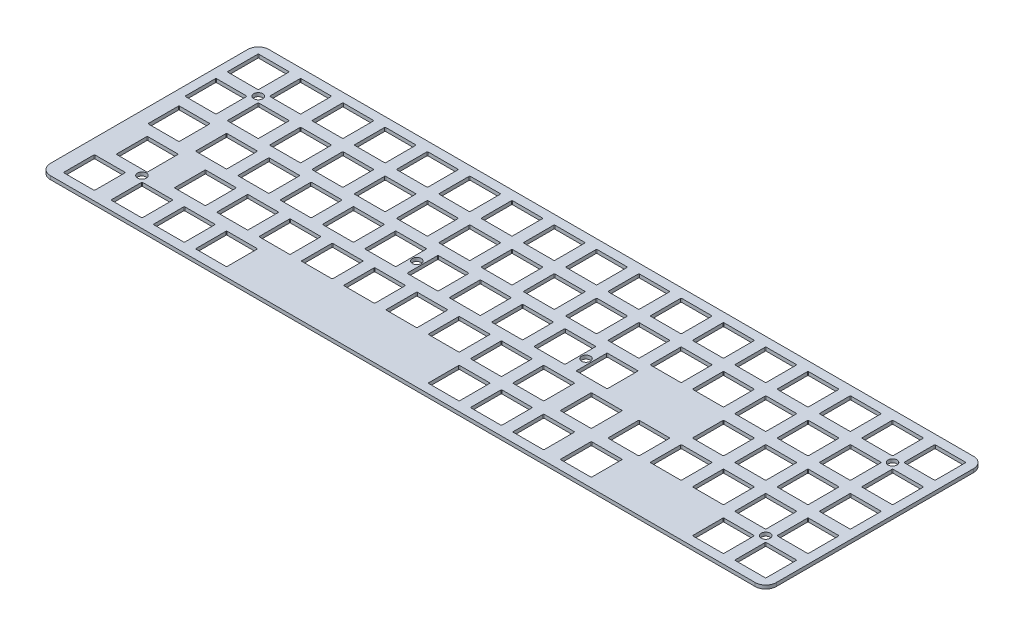
from build123d import *

# Parameters (mm, degrees)
SKETCH2_R           = 2
SKETCH2_W           = 13.9954
SKETCH2_H           = 13.9954
BOSS_EXTRUDE1_DEPTH = 0.79375
FILLET1_R           = 0.3048


with BuildPart() as part:
    # Sketch2 → Boss-Extrude1 (new, symmetric)
    with BuildSketch(Plane(origin=(0, 0, 0), x_dir=(1, 0, 0), z_dir=(0, 1, 0))):
        with BuildLine():
            Line((158.75, -49.2125), (-158.75, -49.2125))
            ThreePointArc((-158.75, -49.2125), (-162.117596045, -47.817596045), (-163.5125, -44.45))
            Line((-163.5125, -44.45), (-163.5125, 44.45))
            ThreePointArc((-163.5125, 44.45), (-162.117596045, 47.817596045), (-158.75, 49.2125))
            Line((-158.75, 49.2125), (158.75, 49.2125))
            ThreePointArc((158.75, 49.2125), (162.117596045, 47.817596045), (163.5125, 44.45))
            Line((163.5125, 44.45), (163.5125, -44.45))
            ThreePointArc((163.5125, -44.45), (162.117596045, -47.817596045), (158.75, -49.2125))
        make_face()
        with Locations((-142.875, 28.575)):
            Circle(SKETCH2_R, mode=Mode.SUBTRACT)
        with Locations((-138.1125, -28.575)):
            Circle(SKETCH2_R, mode=Mode.SUBTRACT)
        with Locations((142.875, 28.575)):
            Circle(SKETCH2_R, mode=Mode.SUBTRACT)
        with Locations((142.875, -28.575)):
            Circle(SKETCH2_R, mode=Mode.SUBTRACT)
        with Locations((-42.8625, 0)):
            Circle(SKETCH2_R, mode=Mode.SUBTRACT)
        with Locations((33.3375, 0)):
            Circle(SKETCH2_R, mode=Mode.SUBTRACT)
        with BuildLine():
            Line((-145.7071, 45.0977), (-159.0929, 45.0977))
            ThreePointArc((-159.0929, 45.0977), (-159.308426147, 45.008426147), (-159.3977, 44.7929))
            Line((-159.3977, 44.7929), (-159.3977, 31.4071))
            ThreePointArc((-159.3977, 31.4071), (-159.308426147, 31.191573853), (-159.0929, 31.1023))
            Line((-159.0929, 31.1023), (-145.7071, 31.1023))
            ThreePointArc((-145.7071, 31.1023), (-145.491573853, 31.191573853), (-145.4023, 31.4071))
            Line((-145.4023, 31.4071), (-145.4023, 44.7929))
            ThreePointArc((-145.4023, 44.7929), (-145.491573853, 45.008426147), (-145.7071, 45.0977))
        make_face(mode=Mode.SUBTRACT)
        with BuildLine():
            Line((-126.6571, 45.0977), (-140.0429, 45.0977))
            ThreePointArc((-140.0429, 45.0977), (-140.258426147, 45.008426147), (-140.3477, 44.7929))
            Line((-140.3477, 44.7929), (-140.3477, 31.4071))
            ThreePointArc((-140.3477, 31.4071), (-140.258426147, 31.191573853), (-140.0429, 31.1023))
            Line((-140.0429, 31.1023), (-126.6571, 31.1023))
            ThreePointArc((-126.6571, 31.1023), (-126.441573853, 31.191573853), (-126.3523, 31.4071))
            Line((-126.3523, 31.4071), (-126.3523, 44.7929))
            ThreePointArc((-126.3523, 44.7929), (-126.441573853, 45.008426147), (-126.6571, 45.0977))
        make_face(mode=Mode.SUBTRACT)
        with BuildLine():
            Line((-107.6071, 45.0977), (-120.9929, 45.0977))
            ThreePointArc((-120.9929, 45.0977), (-121.208426147, 45.008426147), (-121.2977, 44.7929))
            Line((-121.2977, 44.7929), (-121.2977, 31.4071))
            ThreePointArc((-121.2977, 31.4071), (-121.208426147, 31.191573853), (-120.9929, 31.1023))
            Line((-120.9929, 31.1023), (-107.6071, 31.1023))
            ThreePointArc((-107.6071, 31.1023), (-107.391573853, 31.191573853), (-107.3023, 31.4071))
            Line((-107.3023, 31.4071), (-107.3023, 44.7929))
            ThreePointArc((-107.3023, 44.7929), (-107.391573853, 45.008426147), (-107.6071, 45.0977))
        make_face(mode=Mode.SUBTRACT)
        with BuildLine():
            Line((-88.5571, 45.0977), (-101.9429, 45.0977))
            ThreePointArc((-101.9429, 45.0977), (-102.158426147, 45.008426147), (-102.2477, 44.7929))
            Line((-102.2477, 44.7929), (-102.2477, 31.4071))
            ThreePointArc((-102.2477, 31.4071), (-102.158426147, 31.191573853), (-101.9429, 31.1023))
            Line((-101.9429, 31.1023), (-88.5571, 31.1023))
            ThreePointArc((-88.5571, 31.1023), (-88.341573853, 31.191573853), (-88.2523, 31.4071))
            Line((-88.2523, 31.4071), (-88.2523, 44.7929))
            ThreePointArc((-88.2523, 44.7929), (-88.341573853, 45.008426147), (-88.5571, 45.0977))
        make_face(mode=Mode.SUBTRACT)
        with BuildLine():
            Line((-69.5071, 45.0977), (-82.8929, 45.0977))
            ThreePointArc((-82.8929, 45.0977), (-83.108426147, 45.008426147), (-83.1977, 44.7929))
            Line((-83.1977, 44.7929), (-83.1977, 31.4071))
            ThreePointArc((-83.1977, 31.4071), (-83.108426147, 31.191573853), (-82.8929, 31.1023))
            Line((-82.8929, 31.1023), (-69.5071, 31.1023))
            ThreePointArc((-69.5071, 31.1023), (-69.291573853, 31.191573853), (-69.2023, 31.4071))
            Line((-69.2023, 31.4071), (-69.2023, 44.7929))
            ThreePointArc((-69.2023, 44.7929), (-69.291573853, 45.008426147), (-69.5071, 45.0977))
        make_face(mode=Mode.SUBTRACT)
        with BuildLine():
            Line((-50.4571, 45.0977), (-63.8429, 45.0977))
            ThreePointArc((-63.8429, 45.0977), (-64.058426147, 45.008426147), (-64.1477, 44.7929))
            Line((-64.1477, 44.7929), (-64.1477, 31.4071))
            ThreePointArc((-64.1477, 31.4071), (-64.058426147, 31.191573853), (-63.8429, 31.1023))
            Line((-63.8429, 31.1023), (-50.4571, 31.1023))
            ThreePointArc((-50.4571, 31.1023), (-50.241573853, 31.191573853), (-50.1523, 31.4071))
            Line((-50.1523, 31.4071), (-50.1523, 44.7929))
            ThreePointArc((-50.1523, 44.7929), (-50.241573853, 45.008426147), (-50.4571, 45.0977))
        make_face(mode=Mode.SUBTRACT)
        with BuildLine():
            Line((-31.4071, 45.0977), (-44.7929, 45.0977))
            ThreePointArc((-44.7929, 45.0977), (-45.008426147, 45.008426147), (-45.0977, 44.7929))
            Line((-45.0977, 44.7929), (-45.0977, 31.4071))
            ThreePointArc((-45.0977, 31.4071), (-45.008426147, 31.191573853), (-44.7929, 31.1023))
            Line((-44.7929, 31.1023), (-31.4071, 31.1023))
            ThreePointArc((-31.4071, 31.1023), (-31.191573853, 31.191573853), (-31.1023, 31.4071))
            Line((-31.1023, 31.4071), (-31.1023, 44.7929))
            ThreePointArc((-31.1023, 44.7929), (-31.191573853, 45.008426147), (-31.4071, 45.0977))
        make_face(mode=Mode.SUBTRACT)
        with BuildLine():
            Line((-12.3571, 45.0977), (-25.7429, 45.0977))
            ThreePointArc((-25.7429, 45.0977), (-25.958426147, 45.008426147), (-26.0477, 44.7929))
            Line((-26.0477, 44.7929), (-26.0477, 31.4071))
            ThreePointArc((-26.0477, 31.4071), (-25.958426147, 31.191573853), (-25.7429, 31.1023))
            Line((-25.7429, 31.1023), (-12.3571, 31.1023))
            ThreePointArc((-12.3571, 31.1023), (-12.141573853, 31.191573853), (-12.0523, 31.4071))
            Line((-12.0523, 31.4071), (-12.0523, 44.7929))
            ThreePointArc((-12.0523, 44.7929), (-12.141573853, 45.008426147), (-12.3571, 45.0977))
        make_face(mode=Mode.SUBTRACT)
        with BuildLine():
            Line((6.6929, 45.0977), (-6.6929, 45.0977))
            ThreePointArc((-6.6929, 45.0977), (-6.908426147, 45.008426147), (-6.9977, 44.7929))
            Line((-6.9977, 44.7929), (-6.9977, 31.4071))
            ThreePointArc((-6.9977, 31.4071), (-6.908426147, 31.191573853), (-6.6929, 31.1023))
            Line((-6.6929, 31.1023), (6.6929, 31.1023))
            ThreePointArc((6.6929, 31.1023), (6.908426147, 31.191573853), (6.9977, 31.4071))
            Line((6.9977, 31.4071), (6.9977, 44.7929))
            ThreePointArc((6.9977, 44.7929), (6.908426147, 45.008426147), (6.6929, 45.0977))
        make_face(mode=Mode.SUBTRACT)
        with BuildLine():
            Line((25.7429, 45.0977), (12.3571, 45.0977))
            ThreePointArc((12.3571, 45.0977), (12.141573853, 45.008426147), (12.0523, 44.7929))
            Line((12.0523, 44.7929), (12.0523, 31.4071))
            ThreePointArc((12.0523, 31.4071), (12.141573853, 31.191573853), (12.3571, 31.1023))
            Line((12.3571, 31.1023), (25.7429, 31.1023))
            ThreePointArc((25.7429, 31.1023), (25.958426147, 31.191573853), (26.0477, 31.4071))
            Line((26.0477, 31.4071), (26.0477, 44.7929))
            ThreePointArc((26.0477, 44.7929), (25.958426147, 45.008426147), (25.7429, 45.0977))
        make_face(mode=Mode.SUBTRACT)
        with BuildLine():
            Line((44.7929, 45.0977), (31.4071, 45.0977))
            ThreePointArc((31.4071, 45.0977), (31.191573853, 45.008426147), (31.1023, 44.7929))
            Line((31.1023, 44.7929), (31.1023, 31.4071))
            ThreePointArc((31.1023, 31.4071), (31.191573853, 31.191573853), (31.4071, 31.1023))
            Line((31.4071, 31.1023), (44.7929, 31.1023))
            ThreePointArc((44.7929, 31.1023), (45.008426147, 31.191573853), (45.0977, 31.4071))
            Line((45.0977, 31.4071), (45.0977, 44.7929))
            ThreePointArc((45.0977, 44.7929), (45.008426147, 45.008426147), (44.7929, 45.0977))
        make_face(mode=Mode.SUBTRACT)
        with BuildLine():
            Line((63.8429, 45.0977), (50.4571, 45.0977))
            ThreePointArc((50.4571, 45.0977), (50.241573853, 45.008426147), (50.1523, 44.7929))
            Line((50.1523, 44.7929), (50.1523, 31.4071))
            ThreePointArc((50.1523, 31.4071), (50.241573853, 31.191573853), (50.4571, 31.1023))
            Line((50.4571, 31.1023), (63.8429, 31.1023))
            ThreePointArc((63.8429, 31.1023), (64.058426147, 31.191573853), (64.1477, 31.4071))
            Line((64.1477, 31.4071), (64.1477, 44.7929))
            ThreePointArc((64.1477, 44.7929), (64.058426147, 45.008426147), (63.8429, 45.0977))
        make_face(mode=Mode.SUBTRACT)
        with BuildLine():
            Line((82.8929, 45.0977), (69.5071, 45.0977))
            ThreePointArc((69.5071, 45.0977), (69.291573853, 45.008426147), (69.2023, 44.7929))
            Line((69.2023, 44.7929), (69.2023, 31.4071))
            ThreePointArc((69.2023, 31.4071), (69.291573853, 31.191573853), (69.5071, 31.1023))
            Line((69.5071, 31.1023), (82.8929, 31.1023))
            ThreePointArc((82.8929, 31.1023), (83.108426147, 31.191573853), (83.1977, 31.4071))
            Line((83.1977, 31.4071), (83.1977, 44.7929))
            ThreePointArc((83.1977, 44.7929), (83.108426147, 45.008426147), (82.8929, 45.0977))
        make_face(mode=Mode.SUBTRACT)
        with BuildLine():
            Line((101.9429, 45.0977), (88.5571, 45.0977))
            ThreePointArc((88.5571, 45.0977), (88.341573853, 45.008426147), (88.2523, 44.7929))
            Line((88.2523, 44.7929), (88.2523, 31.4071))
            ThreePointArc((88.2523, 31.4071), (88.341573853, 31.191573853), (88.5571, 31.1023))
            Line((88.5571, 31.1023), (101.9429, 31.1023))
            ThreePointArc((101.9429, 31.1023), (102.158426147, 31.191573853), (102.2477, 31.4071))
            Line((102.2477, 31.4071), (102.2477, 44.7929))
            ThreePointArc((102.2477, 44.7929), (102.158426147, 45.008426147), (101.9429, 45.0977))
        make_face(mode=Mode.SUBTRACT)
        with BuildLine():
            Line((120.9929, 45.0977), (107.6071, 45.0977))
            ThreePointArc((107.6071, 45.0977), (107.391573853, 45.008426147), (107.3023, 44.7929))
            Line((107.3023, 44.7929), (107.3023, 31.4071))
            ThreePointArc((107.3023, 31.4071), (107.391573853, 31.191573853), (107.6071, 31.1023))
            Line((107.6071, 31.1023), (120.9929, 31.1023))
            ThreePointArc((120.9929, 31.1023), (121.208426147, 31.191573853), (121.2977, 31.4071))
            Line((121.2977, 31.4071), (121.2977, 44.7929))
            ThreePointArc((121.2977, 44.7929), (121.208426147, 45.008426147), (120.9929, 45.0977))
        make_face(mode=Mode.SUBTRACT)
        with BuildLine():
            Line((140.0429, 45.0977), (126.6571, 45.0977))
            ThreePointArc((126.6571, 45.0977), (126.441573853, 45.008426147), (126.3523, 44.7929))
            Line((126.3523, 44.7929), (126.3523, 31.4071))
            ThreePointArc((126.3523, 31.4071), (126.441573853, 31.191573853), (126.6571, 31.1023))
            Line((126.6571, 31.1023), (140.0429, 31.1023))
            ThreePointArc((140.0429, 31.1023), (140.258426147, 31.191573853), (140.3477, 31.4071))
            Line((140.3477, 31.4071), (140.3477, 44.7929))
            ThreePointArc((140.3477, 44.7929), (140.258426147, 45.008426147), (140.0429, 45.0977))
        make_face(mode=Mode.SUBTRACT)
        with BuildLine():
            Line((159.0929, 45.0977), (145.7071, 45.0977))
            ThreePointArc((145.7071, 45.0977), (145.491573853, 45.008426147), (145.4023, 44.7929))
            Line((145.4023, 44.7929), (145.4023, 31.4071))
            ThreePointArc((145.4023, 31.4071), (145.491573853, 31.191573853), (145.7071, 31.1023))
            Line((145.7071, 31.1023), (159.0929, 31.1023))
            ThreePointArc((159.0929, 31.1023), (159.308426147, 31.191573853), (159.3977, 31.4071))
            Line((159.3977, 31.4071), (159.3977, 44.7929))
            ThreePointArc((159.3977, 44.7929), (159.308426147, 45.008426147), (159.0929, 45.0977))
        make_face(mode=Mode.SUBTRACT)
        with BuildLine():
            Line((-126.6571, 26.0477), (-140.0429, 26.0477))
            ThreePointArc((-140.0429, 26.0477), (-140.258426147, 25.958426147), (-140.3477, 25.7429))
            Line((-140.3477, 25.7429), (-140.3477, 12.3571))
            ThreePointArc((-140.3477, 12.3571), (-140.258426147, 12.141573853), (-140.0429, 12.0523))
            Line((-140.0429, 12.0523), (-126.6571, 12.0523))
            ThreePointArc((-126.6571, 12.0523), (-126.441573853, 12.141573853), (-126.3523, 12.3571))
            Line((-126.3523, 12.3571), (-126.3523, 25.7429))
            ThreePointArc((-126.3523, 25.7429), (-126.441573853, 25.958426147), (-126.6571, 26.0477))
        make_face(mode=Mode.SUBTRACT)
        with BuildLine():
            Line((-107.6071, 26.0477), (-120.9929, 26.0477))
            ThreePointArc((-120.9929, 26.0477), (-121.208426147, 25.958426147), (-121.2977, 25.7429))
            Line((-121.2977, 25.7429), (-121.2977, 12.3571))
            ThreePointArc((-121.2977, 12.3571), (-121.208426147, 12.141573853), (-120.9929, 12.0523))
            Line((-120.9929, 12.0523), (-107.6071, 12.0523))
            ThreePointArc((-107.6071, 12.0523), (-107.391573853, 12.141573853), (-107.3023, 12.3571))
            Line((-107.3023, 12.3571), (-107.3023, 25.7429))
            ThreePointArc((-107.3023, 25.7429), (-107.391573853, 25.958426147), (-107.6071, 26.0477))
        make_face(mode=Mode.SUBTRACT)
        with BuildLine():
            Line((-88.5571, 26.0477), (-101.9429, 26.0477))
            ThreePointArc((-101.9429, 26.0477), (-102.158426147, 25.958426147), (-102.2477, 25.7429))
            Line((-102.2477, 25.7429), (-102.2477, 12.3571))
            ThreePointArc((-102.2477, 12.3571), (-102.158426147, 12.141573853), (-101.9429, 12.0523))
            Line((-101.9429, 12.0523), (-88.5571, 12.0523))
            ThreePointArc((-88.5571, 12.0523), (-88.341573853, 12.141573853), (-88.2523, 12.3571))
            Line((-88.2523, 12.3571), (-88.2523, 25.7429))
            ThreePointArc((-88.2523, 25.7429), (-88.341573853, 25.958426147), (-88.5571, 26.0477))
        make_face(mode=Mode.SUBTRACT)
        with BuildLine():
            Line((-69.5071, 26.0477), (-82.8929, 26.0477))
            ThreePointArc((-82.8929, 26.0477), (-83.108426147, 25.958426147), (-83.1977, 25.7429))
            Line((-83.1977, 25.7429), (-83.1977, 12.3571))
            ThreePointArc((-83.1977, 12.3571), (-83.108426147, 12.141573853), (-82.8929, 12.0523))
            Line((-82.8929, 12.0523), (-69.5071, 12.0523))
            ThreePointArc((-69.5071, 12.0523), (-69.291573853, 12.141573853), (-69.2023, 12.3571))
            Line((-69.2023, 12.3571), (-69.2023, 25.7429))
            ThreePointArc((-69.2023, 25.7429), (-69.291573853, 25.958426147), (-69.5071, 26.0477))
        make_face(mode=Mode.SUBTRACT)
        with BuildLine():
            Line((-50.4571, 26.0477), (-63.8429, 26.0477))
            ThreePointArc((-63.8429, 26.0477), (-64.058426147, 25.958426147), (-64.1477, 25.7429))
            Line((-64.1477, 25.7429), (-64.1477, 12.3571))
            ThreePointArc((-64.1477, 12.3571), (-64.058426147, 12.141573853), (-63.8429, 12.0523))
            Line((-63.8429, 12.0523), (-50.4571, 12.0523))
            ThreePointArc((-50.4571, 12.0523), (-50.241573853, 12.141573853), (-50.1523, 12.3571))
            Line((-50.1523, 12.3571), (-50.1523, 25.7429))
            ThreePointArc((-50.1523, 25.7429), (-50.241573853, 25.958426147), (-50.4571, 26.0477))
        make_face(mode=Mode.SUBTRACT)
        with BuildLine():
            Line((-31.4071, 26.0477), (-44.7929, 26.0477))
            ThreePointArc((-44.7929, 26.0477), (-45.008426147, 25.958426147), (-45.0977, 25.7429))
            Line((-45.0977, 25.7429), (-45.0977, 12.3571))
            ThreePointArc((-45.0977, 12.3571), (-45.008426147, 12.141573853), (-44.7929, 12.0523))
            Line((-44.7929, 12.0523), (-31.4071, 12.0523))
            ThreePointArc((-31.4071, 12.0523), (-31.191573853, 12.141573853), (-31.1023, 12.3571))
            Line((-31.1023, 12.3571), (-31.1023, 25.7429))
            ThreePointArc((-31.1023, 25.7429), (-31.191573853, 25.958426147), (-31.4071, 26.0477))
        make_face(mode=Mode.SUBTRACT)
        with BuildLine():
            Line((-12.3571, 26.0477), (-25.7429, 26.0477))
            ThreePointArc((-25.7429, 26.0477), (-25.958426147, 25.958426147), (-26.0477, 25.7429))
            Line((-26.0477, 25.7429), (-26.0477, 12.3571))
            ThreePointArc((-26.0477, 12.3571), (-25.958426147, 12.141573853), (-25.7429, 12.0523))
            Line((-25.7429, 12.0523), (-12.3571, 12.0523))
            ThreePointArc((-12.3571, 12.0523), (-12.141573853, 12.141573853), (-12.0523, 12.3571))
            Line((-12.0523, 12.3571), (-12.0523, 25.7429))
            ThreePointArc((-12.0523, 25.7429), (-12.141573853, 25.958426147), (-12.3571, 26.0477))
        make_face(mode=Mode.SUBTRACT)
        with BuildLine():
            Line((6.6929, 26.0477), (-6.6929, 26.0477))
            ThreePointArc((-6.6929, 26.0477), (-6.908426147, 25.958426147), (-6.9977, 25.7429))
            Line((-6.9977, 25.7429), (-6.9977, 12.3571))
            ThreePointArc((-6.9977, 12.3571), (-6.908426147, 12.141573853), (-6.6929, 12.0523))
            Line((-6.6929, 12.0523), (6.6929, 12.0523))
            ThreePointArc((6.6929, 12.0523), (6.908426147, 12.141573853), (6.9977, 12.3571))
            Line((6.9977, 12.3571), (6.9977, 25.7429))
            ThreePointArc((6.9977, 25.7429), (6.908426147, 25.958426147), (6.6929, 26.0477))
        make_face(mode=Mode.SUBTRACT)
        with BuildLine():
            Line((25.7429, 26.0477), (12.3571, 26.0477))
            ThreePointArc((12.3571, 26.0477), (12.141573853, 25.958426147), (12.0523, 25.7429))
            Line((12.0523, 25.7429), (12.0523, 12.3571))
            ThreePointArc((12.0523, 12.3571), (12.141573853, 12.141573853), (12.3571, 12.0523))
            Line((12.3571, 12.0523), (25.7429, 12.0523))
            ThreePointArc((25.7429, 12.0523), (25.958426147, 12.141573853), (26.0477, 12.3571))
            Line((26.0477, 12.3571), (26.0477, 25.7429))
            ThreePointArc((26.0477, 25.7429), (25.958426147, 25.958426147), (25.7429, 26.0477))
        make_face(mode=Mode.SUBTRACT)
        with BuildLine():
            Line((44.7929, 26.0477), (31.4071, 26.0477))
            ThreePointArc((31.4071, 26.0477), (31.191573853, 25.958426147), (31.1023, 25.7429))
            Line((31.1023, 25.7429), (31.1023, 12.3571))
            ThreePointArc((31.1023, 12.3571), (31.191573853, 12.141573853), (31.4071, 12.0523))
            Line((31.4071, 12.0523), (44.7929, 12.0523))
            ThreePointArc((44.7929, 12.0523), (45.008426147, 12.141573853), (45.0977, 12.3571))
            Line((45.0977, 12.3571), (45.0977, 25.7429))
            ThreePointArc((45.0977, 25.7429), (45.008426147, 25.958426147), (44.7929, 26.0477))
        make_face(mode=Mode.SUBTRACT)
        with BuildLine():
            Line((63.8429, 26.0477), (50.4571, 26.0477))
            ThreePointArc((50.4571, 26.0477), (50.241573853, 25.958426147), (50.1523, 25.7429))
            Line((50.1523, 25.7429), (50.1523, 12.3571))
            ThreePointArc((50.1523, 12.3571), (50.241573853, 12.141573853), (50.4571, 12.0523))
            Line((50.4571, 12.0523), (63.8429, 12.0523))
            ThreePointArc((63.8429, 12.0523), (64.058426147, 12.141573853), (64.1477, 12.3571))
            Line((64.1477, 12.3571), (64.1477, 25.7429))
            ThreePointArc((64.1477, 25.7429), (64.058426147, 25.958426147), (63.8429, 26.0477))
        make_face(mode=Mode.SUBTRACT)
        with BuildLine():
            Line((82.8929, 26.0477), (69.5071, 26.0477))
            ThreePointArc((69.5071, 26.0477), (69.291573853, 25.958426147), (69.2023, 25.7429))
            Line((69.2023, 25.7429), (69.2023, 12.3571))
            ThreePointArc((69.2023, 12.3571), (69.291573853, 12.141573853), (69.5071, 12.0523))
            Line((69.5071, 12.0523), (82.8929, 12.0523))
            ThreePointArc((82.8929, 12.0523), (83.108426147, 12.141573853), (83.1977, 12.3571))
            Line((83.1977, 12.3571), (83.1977, 25.7429))
            ThreePointArc((83.1977, 25.7429), (83.108426147, 25.958426147), (82.8929, 26.0477))
        make_face(mode=Mode.SUBTRACT)
        with BuildLine():
            Line((101.9429, 26.0477), (88.5571, 26.0477))
            ThreePointArc((88.5571, 26.0477), (88.341573853, 25.958426147), (88.2523, 25.7429))
            Line((88.2523, 25.7429), (88.2523, 12.3571))
            ThreePointArc((88.2523, 12.3571), (88.341573853, 12.141573853), (88.5571, 12.0523))
            Line((88.5571, 12.0523), (101.9429, 12.0523))
            ThreePointArc((101.9429, 12.0523), (102.158426147, 12.141573853), (102.2477, 12.3571))
            Line((102.2477, 12.3571), (102.2477, 25.7429))
            ThreePointArc((102.2477, 25.7429), (102.158426147, 25.958426147), (101.9429, 26.0477))
        make_face(mode=Mode.SUBTRACT)
        with BuildLine():
            Line((120.9929, 26.0477), (107.6071, 26.0477))
            ThreePointArc((107.6071, 26.0477), (107.391573853, 25.958426147), (107.3023, 25.7429))
            Line((107.3023, 25.7429), (107.3023, 12.3571))
            ThreePointArc((107.3023, 12.3571), (107.391573853, 12.141573853), (107.6071, 12.0523))
            Line((107.6071, 12.0523), (120.9929, 12.0523))
            ThreePointArc((120.9929, 12.0523), (121.208426147, 12.141573853), (121.2977, 12.3571))
            Line((121.2977, 12.3571), (121.2977, 25.7429))
            ThreePointArc((121.2977, 25.7429), (121.208426147, 25.958426147), (120.9929, 26.0477))
        make_face(mode=Mode.SUBTRACT)
        with BuildLine():
            Line((140.0429, 26.0477), (126.6571, 26.0477))
            ThreePointArc((126.6571, 26.0477), (126.441573853, 25.958426147), (126.3523, 25.7429))
            Line((126.3523, 25.7429), (126.3523, 12.3571))
            ThreePointArc((126.3523, 12.3571), (126.441573853, 12.141573853), (126.6571, 12.0523))
            Line((126.6571, 12.0523), (140.0429, 12.0523))
            ThreePointArc((140.0429, 12.0523), (140.258426147, 12.141573853), (140.3477, 12.3571))
            Line((140.3477, 12.3571), (140.3477, 25.7429))
            ThreePointArc((140.3477, 25.7429), (140.258426147, 25.958426147), (140.0429, 26.0477))
        make_face(mode=Mode.SUBTRACT)
        with BuildLine():
            Line((159.0929, 26.0477), (145.7071, 26.0477))
            ThreePointArc((145.7071, 26.0477), (145.491573853, 25.958426147), (145.4023, 25.7429))
            Line((145.4023, 25.7429), (145.4023, 12.3571))
            ThreePointArc((145.4023, 12.3571), (145.491573853, 12.141573853), (145.7071, 12.0523))
            Line((145.7071, 12.0523), (159.0929, 12.0523))
            ThreePointArc((159.0929, 12.0523), (159.308426147, 12.141573853), (159.3977, 12.3571))
            Line((159.3977, 12.3571), (159.3977, 25.7429))
            ThreePointArc((159.3977, 25.7429), (159.308426147, 25.958426147), (159.0929, 26.0477))
        make_face(mode=Mode.SUBTRACT)
        with BuildLine():
            Line((-145.7071, 26.0477), (-159.0929, 26.0477))
            ThreePointArc((-159.0929, 26.0477), (-159.308426147, 25.958426147), (-159.3977, 25.7429))
            Line((-159.3977, 25.7429), (-159.3977, 12.3571))
            ThreePointArc((-159.3977, 12.3571), (-159.308426147, 12.141573853), (-159.0929, 12.0523))
            Line((-159.0929, 12.0523), (-145.7071, 12.0523))
            ThreePointArc((-145.7071, 12.0523), (-145.491573853, 12.141573853), (-145.4023, 12.3571))
            Line((-145.4023, 12.3571), (-145.4023, 25.7429))
            ThreePointArc((-145.4023, 25.7429), (-145.491573853, 25.958426147), (-145.7071, 26.0477))
        make_face(mode=Mode.SUBTRACT)
        with Locations((-150.01875, 0)):
            Rectangle(SKETCH2_W, SKETCH2_H, mode=Mode.SUBTRACT)
        with Locations((-145.25625, -19.05)):
            Rectangle(SKETCH2_W, SKETCH2_H, mode=Mode.SUBTRACT)
        with Locations((-150.01875, -38.1)):
            Rectangle(SKETCH2_W, SKETCH2_H, mode=Mode.SUBTRACT)
        with Locations((-128.5875, 0)):
            Rectangle(SKETCH2_W, SKETCH2_H, mode=Mode.SUBTRACT)
        with Locations((-119.0625, -19.05)):
            Rectangle(SKETCH2_W, SKETCH2_H, mode=Mode.SUBTRACT)
        with Locations((-128.5875, -38.1)):
            Rectangle(SKETCH2_W, SKETCH2_H, mode=Mode.SUBTRACT)
        with Locations((-109.5375, 0)):
            Rectangle(SKETCH2_W, SKETCH2_H, mode=Mode.SUBTRACT)
        with Locations((-90.4875, 0)):
            Rectangle(SKETCH2_W, SKETCH2_H, mode=Mode.SUBTRACT)
        with Locations((-71.4375, 0)):
            Rectangle(SKETCH2_W, SKETCH2_H, mode=Mode.SUBTRACT)
        with Locations((-52.3875, 0)):
            Rectangle(SKETCH2_W, SKETCH2_H, mode=Mode.SUBTRACT)
        with Locations((-33.3375, 0)):
            Rectangle(SKETCH2_W, SKETCH2_H, mode=Mode.SUBTRACT)
        with Locations((-14.2875, 0)):
            Rectangle(SKETCH2_W, SKETCH2_H, mode=Mode.SUBTRACT)
        with Locations((4.7625, 0)):
            Rectangle(SKETCH2_W, SKETCH2_H, mode=Mode.SUBTRACT)
        with Locations((23.8125, 0)):
            Rectangle(SKETCH2_W, SKETCH2_H, mode=Mode.SUBTRACT)
        with Locations((42.8625, 0)):
            Rectangle(SKETCH2_W, SKETCH2_H, mode=Mode.SUBTRACT)
        with Locations((-100.0125, -19.05)):
            Rectangle(SKETCH2_W, SKETCH2_H, mode=Mode.SUBTRACT)
        with Locations((-80.9625, -19.05)):
            Rectangle(SKETCH2_W, SKETCH2_H, mode=Mode.SUBTRACT)
        with Locations((-61.9125, -19.05)):
            Rectangle(SKETCH2_W, SKETCH2_H, mode=Mode.SUBTRACT)
        with Locations((-42.8625, -19.05)):
            Rectangle(SKETCH2_W, SKETCH2_H, mode=Mode.SUBTRACT)
        with Locations((-23.8125, -19.05)):
            Rectangle(SKETCH2_W, SKETCH2_H, mode=Mode.SUBTRACT)
        with Locations((-4.7625, -19.05)):
            Rectangle(SKETCH2_W, SKETCH2_H, mode=Mode.SUBTRACT)
        with Locations((14.2875, -19.05)):
            Rectangle(SKETCH2_W, SKETCH2_H, mode=Mode.SUBTRACT)
        with Locations((33.3375, -19.05)):
            Rectangle(SKETCH2_W, SKETCH2_H, mode=Mode.SUBTRACT)
        with Locations((-109.5375, -38.1)):
            Rectangle(SKETCH2_W, SKETCH2_H, mode=Mode.SUBTRACT)
        with Locations((-90.4875, -38.1)):
            Rectangle(SKETCH2_W, SKETCH2_H, mode=Mode.SUBTRACT)
        with BuildLine():
            Line((101.9429, -6.9977), (88.5571, -6.9977))
            ThreePointArc((88.5571, -6.9977), (88.341573853, -6.908426147), (88.2523, -6.6929))
            Line((88.2523, -6.6929), (88.2523, 6.6929))
            ThreePointArc((88.2523, 6.6929), (88.341573853, 6.908426147), (88.5571, 6.9977))
            Line((88.5571, 6.9977), (101.9429, 6.9977))
            ThreePointArc((101.9429, 6.9977), (102.158426147, 6.908426147), (102.2477, 6.6929))
            Line((102.2477, 6.6929), (102.2477, -6.6929))
            ThreePointArc((102.2477, -6.6929), (102.158426147, -6.908426147), (101.9429, -6.9977))
        make_face(mode=Mode.SUBTRACT)
        with Locations((14.2875, -38.1)):
            Rectangle(SKETCH2_W, SKETCH2_H, mode=Mode.SUBTRACT)
        with Locations((33.3375, -38.1)):
            Rectangle(SKETCH2_W, SKETCH2_H, mode=Mode.SUBTRACT)
        with Locations((52.3875, -38.1)):
            Rectangle(SKETCH2_W, SKETCH2_H, mode=Mode.SUBTRACT)
        with Locations((73.81875, -38.1)):
            Rectangle(SKETCH2_W, SKETCH2_H, mode=Mode.SUBTRACT)
        with BuildLine():
            Line((120.9929, -6.9977), (107.6071, -6.9977))
            ThreePointArc((107.6071, -6.9977), (107.391573853, -6.908426147), (107.3023, -6.6929))
            Line((107.3023, -6.6929), (107.3023, 6.6929))
            ThreePointArc((107.3023, 6.6929), (107.391573853, 6.908426147), (107.6071, 6.9977))
            Line((107.6071, 6.9977), (120.9929, 6.9977))
            ThreePointArc((120.9929, 6.9977), (121.208426147, 6.908426147), (121.2977, 6.6929))
            Line((121.2977, 6.6929), (121.2977, -6.6929))
            ThreePointArc((121.2977, -6.6929), (121.208426147, -6.908426147), (120.9929, -6.9977))
        make_face(mode=Mode.SUBTRACT)
        with BuildLine():
            Line((140.0429, 6.9977), (126.6571, 6.9977))
            ThreePointArc((126.6571, 6.9977), (126.441573853, 6.908426147), (126.3523, 6.6929))
            Line((126.3523, 6.6929), (126.3523, -6.6929))
            ThreePointArc((126.3523, -6.6929), (126.441573853, -6.908426147), (126.6571, -6.9977))
            Line((126.6571, -6.9977), (140.0429, -6.9977))
            ThreePointArc((140.0429, -6.9977), (140.258426147, -6.908426147), (140.3477, -6.6929))
            Line((140.3477, -6.6929), (140.3477, 6.6929))
            ThreePointArc((140.3477, 6.6929), (140.258426147, 6.908426147), (140.0429, 6.9977))
        make_face(mode=Mode.SUBTRACT)
        with BuildLine():
            Line((159.3977, 6.6929), (159.3977, -6.6929))
            ThreePointArc((159.3977, -6.6929), (159.308426147, -6.908426147), (159.0929, -6.9977))
            Line((159.0929, -6.9977), (145.7071, -6.9977))
            ThreePointArc((145.7071, -6.9977), (145.491573853, -6.908426147), (145.4023, -6.6929))
            Line((145.4023, -6.6929), (145.4023, 6.6929))
            ThreePointArc((145.4023, 6.6929), (145.491573853, 6.908426147), (145.7071, 6.9977))
            Line((145.7071, 6.9977), (159.0929, 6.9977))
            ThreePointArc((159.0929, 6.9977), (159.308426147, 6.908426147), (159.3977, 6.6929))
        make_face(mode=Mode.SUBTRACT)
        with BuildLine():
            Line((101.9429, -26.0477), (88.5571, -26.0477))
            ThreePointArc((88.5571, -26.0477), (88.341573853, -25.958426147), (88.2523, -25.7429))
            Line((88.2523, -25.7429), (88.2523, -12.3571))
            ThreePointArc((88.2523, -12.3571), (88.341573853, -12.141573853), (88.5571, -12.0523))
            Line((88.5571, -12.0523), (101.9429, -12.0523))
            ThreePointArc((101.9429, -12.0523), (102.158426147, -12.141573853), (102.2477, -12.3571))
            Line((102.2477, -12.3571), (102.2477, -25.7429))
            ThreePointArc((102.2477, -25.7429), (102.158426147, -25.958426147), (101.9429, -26.0477))
        make_face(mode=Mode.SUBTRACT)
        with BuildLine():
            Line((120.9929, -26.0477), (107.6071, -26.0477))
            ThreePointArc((107.6071, -26.0477), (107.391573853, -25.958426147), (107.3023, -25.7429))
            Line((107.3023, -25.7429), (107.3023, -12.3571))
            ThreePointArc((107.3023, -12.3571), (107.391573853, -12.141573853), (107.6071, -12.0523))
            Line((107.6071, -12.0523), (120.9929, -12.0523))
            ThreePointArc((120.9929, -12.0523), (121.208426147, -12.141573853), (121.2977, -12.3571))
            Line((121.2977, -12.3571), (121.2977, -25.7429))
            ThreePointArc((121.2977, -25.7429), (121.208426147, -25.958426147), (120.9929, -26.0477))
        make_face(mode=Mode.SUBTRACT)
        with BuildLine():
            Line((140.0429, -12.0523), (126.6571, -12.0523))
            ThreePointArc((126.6571, -12.0523), (126.441573853, -12.141573853), (126.3523, -12.3571))
            Line((126.3523, -12.3571), (126.3523, -25.7429))
            ThreePointArc((126.3523, -25.7429), (126.441573853, -25.958426147), (126.6571, -26.0477))
            Line((126.6571, -26.0477), (140.0429, -26.0477))
            ThreePointArc((140.0429, -26.0477), (140.258426147, -25.958426147), (140.3477, -25.7429))
            Line((140.3477, -25.7429), (140.3477, -12.3571))
            ThreePointArc((140.3477, -12.3571), (140.258426147, -12.141573853), (140.0429, -12.0523))
        make_face(mode=Mode.SUBTRACT)
        with BuildLine():
            Line((159.3977, -12.3571), (159.3977, -25.7429))
            ThreePointArc((159.3977, -25.7429), (159.308426147, -25.958426147), (159.0929, -26.0477))
            Line((159.0929, -26.0477), (145.7071, -26.0477))
            ThreePointArc((145.7071, -26.0477), (145.491573853, -25.958426147), (145.4023, -25.7429))
            Line((145.4023, -25.7429), (145.4023, -12.3571))
            ThreePointArc((145.4023, -12.3571), (145.491573853, -12.141573853), (145.7071, -12.0523))
            Line((145.7071, -12.0523), (159.0929, -12.0523))
            ThreePointArc((159.0929, -12.0523), (159.308426147, -12.141573853), (159.3977, -12.3571))
        make_face(mode=Mode.SUBTRACT)
        with Locations((152.4, -38.1)):
            Rectangle(SKETCH2_W, SKETCH2_H, mode=Mode.SUBTRACT)
        with Locations((133.35, -38.1)):
            Rectangle(SKETCH2_W, SKETCH2_H, mode=Mode.SUBTRACT)
        with Locations((76.2, -19.05)):
            Rectangle(SKETCH2_W, SKETCH2_H, mode=Mode.SUBTRACT)
        with Locations((54.76875, -19.05)):
            Rectangle(SKETCH2_W, SKETCH2_H, mode=Mode.SUBTRACT)
    extrude(amount=BOSS_EXTRUDE1_DEPTH, both=True)

    # Fillet1
    fillet1_edges = [part.edges().sort_by_distance(p)[0] for p in [
        (47.77105, 0, 12.0523),
        (47.77105, 0, 26.0477),
        (61.76645, 0, 26.0477),
        (61.76645, 0, 12.0523),
        (69.2023, 0, 12.0523),
        (69.2023, 0, 26.0477),
        (83.1977, 0, 26.0477),
        (83.1977, 0, 12.0523),
        (126.3523, 0, 31.1023),
        (126.3523, 0, 45.0977),
        (140.3477, 0, 45.0977),
        (140.3477, 0, 31.1023),
        (145.4023, 0, 31.1023),
        (145.4023, 0, 45.0977),
        (159.3977, 0, 45.0977),
        (159.3977, 0, 31.1023),
        (66.82105, 0, 31.1023),
        (66.82105, 0, 45.0977),
        (80.81645, 0, 45.0977),
        (80.81645, 0, 31.1023),
        (45.3898, 0, 31.1023),
        (45.3898, 0, 45.0977),
        (59.3852, 0, 45.0977),
        (59.3852, 0, 31.1023),
        (26.3398, 0, 31.1023),
        (26.3398, 0, 45.0977),
        (40.3352, 0, 45.0977),
        (40.3352, 0, 31.1023),
        (7.2898, 0, 31.1023),
        (7.2898, 0, 45.0977),
        (21.2852, 0, 45.0977),
        (21.2852, 0, 31.1023),
        (-97.4852, 0, 31.1023),
        (-97.4852, 0, 45.0977),
        (-83.4898, 0, 45.0977),
        (-83.4898, 0, 31.1023),
        (40.3352, 0, 26.0477),
        (40.3352, 0, 12.0523),
        (26.3398, 0, 12.0523),
        (26.3398, 0, 26.0477),
        (21.2852, 0, 26.0477),
        (21.2852, 0, 12.0523),
        (7.2898, 0, 12.0523),
        (7.2898, 0, 26.0477),
        (2.2352, 0, 26.0477),
        (2.2352, 0, 12.0523),
        (-11.7602, 0, 12.0523),
        (-11.7602, 0, 26.0477),
        (-16.8148, 0, 26.0477),
        (-16.8148, 0, 12.0523),
        (-30.8102, 0, 12.0523),
        (-30.8102, 0, 26.0477),
        (-35.8648, 0, 26.0477),
        (-35.8648, 0, 12.0523),
        (-49.8602, 0, 12.0523),
        (-49.8602, 0, 26.0477),
        (-54.9148, 0, 26.0477),
        (-54.9148, 0, 12.0523),
        (-68.9102, 0, 12.0523),
        (-68.9102, 0, 26.0477),
        (-73.9648, 0, 26.0477),
        (-73.9648, 0, 12.0523),
        (-87.9602, 0, 12.0523),
        (-87.9602, 0, 26.0477),
        (49.8602, 0, 6.9977),
        (49.8602, 0, -6.9977),
        (35.8648, 0, -6.9977),
        (35.8648, 0, 6.9977),
        (30.8102, 0, 6.9977),
        (30.8102, 0, -6.9977),
        (16.8148, 0, -6.9977),
        (16.8148, 0, 6.9977),
        (11.7602, 0, 6.9977),
        (11.7602, 0, -6.9977),
        (-2.2352, 0, -6.9977),
        (-2.2352, 0, 6.9977),
        (-7.2898, 0, 6.9977),
        (-7.2898, 0, -6.9977),
        (-21.2852, 0, -6.9977),
        (-21.2852, 0, 6.9977),
        (-26.3398, 0, 6.9977),
        (-26.3398, 0, -6.9977),
        (-40.3352, 0, -6.9977),
        (-40.3352, 0, 6.9977),
        (-45.3898, 0, 6.9977),
        (-45.3898, 0, -6.9977),
        (-59.3852, 0, -6.9977),
        (-59.3852, 0, 6.9977),
        (-64.4398, 0, 6.9977),
        (-64.4398, 0, -6.9977),
        (-78.4352, 0, -6.9977),
        (-78.4352, 0, 6.9977),
        (-83.4898, 0, 6.9977),
        (-83.4898, 0, -6.9977),
        (-97.4852, 0, -6.9977),
        (-97.4852, 0, 6.9977),
        (-102.5398, 0, 6.9977),
        (-102.5398, 0, -6.9977),
        (-116.5352, 0, -6.9977),
        (-116.5352, 0, 6.9977),
        (-93.0148, 0, 26.0477),
        (-93.0148, 0, 12.0523),
        (-107.0102, 0, 12.0523),
        (-107.0102, 0, 26.0477),
        (-116.5352, 0, 31.1023),
        (-116.5352, 0, 45.0977),
        (-102.5398, 0, 45.0977),
        (-102.5398, 0, 31.1023),
        (-135.5852, 0, 31.1023),
        (-135.5852, 0, 45.0977),
        (-121.5898, 0, 45.0977),
        (-121.5898, 0, 31.1023),
        (-112.0648, 0, 26.0477),
        (-112.0648, 0, 12.0523),
        (-126.0602, 0, 12.0523),
        (-126.0602, 0, 26.0477),
        (-121.5898, 0, 6.9977),
        (-135.5852, 0, -6.9977),
        (-135.5852, 0, 6.9977),
        (-143.02105, 0, 45.0977),
        (-143.02105, 0, 31.1023),
        (-157.01645, 0, 31.1023),
        (-157.01645, 0, 45.0977),
        (-138.25855, 0, 26.0477),
        (-138.25855, 0, 12.0523),
        (-152.25395, 0, 12.0523),
        (-152.25395, 0, 26.0477),
        (-157.01645, 0, -6.9977),
        (-157.01645, 0, 6.9977),
        (-143.02105, 0, 6.9977),
        (-121.5898, 0, -6.9977),
        (-143.02105, 0, -6.9977),
    ]]
    fillet(fillet1_edges, radius=FILLET1_R)


solid = part.part
